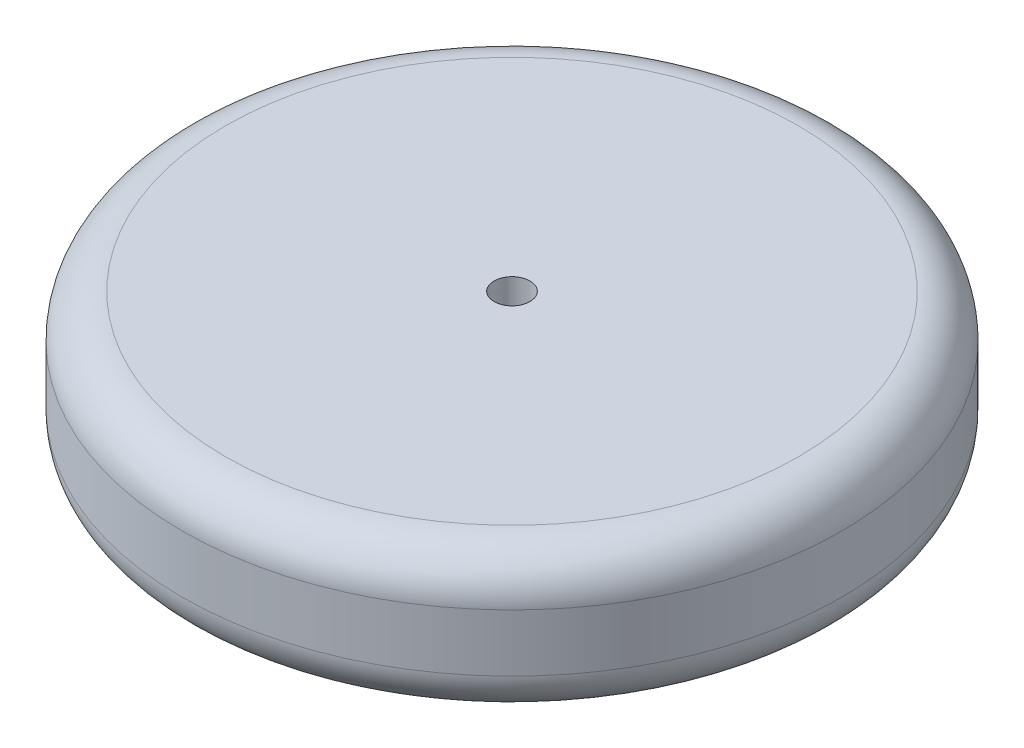
from build123d import *

# Parameters (mm, degrees)
SKETCH1_R           = 292.1
BOSS_EXTRUDE1_DEPTH = 127
FILLET1_R           = 38.1
SKETCH2_R           = 15.875
CUT_EXTRUDE1_DEPTH  = 433.173368058


with BuildPart() as part:
    # Sketch1 → Boss-Extrude1 (new body)
    with BuildSketch(Plane(origin=(0, 0, 0), x_dir=(1, 0, 0), z_dir=(0, 1, 0))):
        Circle(SKETCH1_R)
    extrude(amount=BOSS_EXTRUDE1_DEPTH)

    # Fillet1
    fillet1_edges = [part.edges().sort_by_distance(p)[0] for p in [
        (-292.1, 0, 0),
        (-292.1, 127, 0),
    ]]
    fillet(fillet1_edges, radius=FILLET1_R)

    # Sketch2 → Cut-Extrude1 (cut, through all)
    with BuildSketch(Plane(origin=(0, 127, 0), x_dir=(1, 0, 0), z_dir=(0, 1, 0))):
        Circle(SKETCH2_R)
    extrude(amount=-CUT_EXTRUDE1_DEPTH, mode=Mode.SUBTRACT)


solid = part.part
